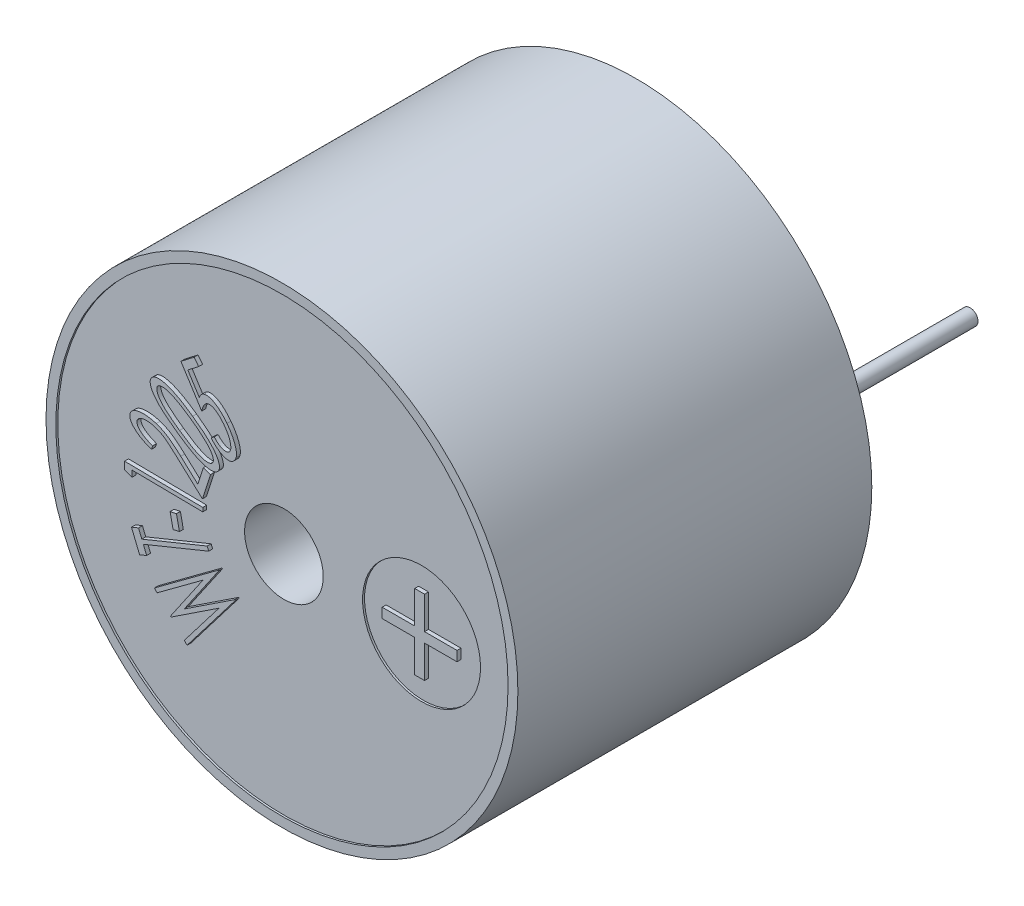
from build123d import *

# Parameters (mm, degrees)
SKETCH_1_R          = 6
EXTRUDE_1_DEPTH     = 9
SKETCH_2_R          = 0.2
EXTRUDE_2_DEPTH     = 5
SKETCH_3_R          = 5.75
CUT_EXTRUDE_1_DEPTH = 0.05
SKETCH_4_R          = 1.5
CUT_EXTRUDE_2_DEPTH = 0.05
SKETCH_5_R          = 1
CUT_EXTRUDE_3_DEPTH = 5
WRAP_1_DEPTH        = 0.1
WRAP_2_DEPTH        = 0.1


# Read off the part's stored shape, not the designer's step: 包覆1, 包覆2
with BuildPart() as part:
    # 草图1 → 凸台-拉伸1 (new body)
    with BuildSketch(Plane.XY):
        Circle(SKETCH_1_R)
    extrude(amount=EXTRUDE_1_DEPTH)

    # 草图2 → 凸台-拉伸2 (add)
    with BuildSketch(Plane.XY):
        with Locations((3.5, 0)):
            Circle(SKETCH_2_R)
        with Locations(Location((-3.5, 0, 0), (0, 0, 180))):
            Circle(SKETCH_2_R)
    extrude(amount=-EXTRUDE_2_DEPTH)

    # 草图3 → 切除-拉伸1 (cut)
    with BuildSketch(Plane.XY.offset(9)):
        Circle(SKETCH_3_R)
    extrude(amount=-CUT_EXTRUDE_1_DEPTH, mode=Mode.SUBTRACT)

    # 草图4 → 切除-拉伸2 (cut)
    with BuildSketch(Plane.XY.offset(8.95)):
        with Locations((3.5, 0)):
            Circle(SKETCH_4_R)
    extrude(amount=-CUT_EXTRUDE_2_DEPTH, mode=Mode.SUBTRACT)

    # 草图5 → 切除-拉伸3 (cut)
    with BuildSketch(Plane.XY.offset(8.95)):
        Circle(SKETCH_5_R)
    extrude(amount=-CUT_EXTRUDE_3_DEPTH, mode=Mode.SUBTRACT)

    # 包覆1 outline → 包覆1 (add)
    with BuildSketch(Plane.XY.offset(8.9)):
        Polygon((3.626336552, 0.954353789), (3.375054501, 0.954353789), (3.375054501, 0.128712764), (2.549413475, 0.128712764), (2.549413475, -0.122569288), (3.375054501, -0.122569288), (3.375054501, -0.948210313), (3.626336552, -0.948210313), (3.626336552, -0.122569288), (4.451977578, -0.122569288), (4.451977578, 0.128712764), (3.626336552, 0.128712764), align=None)
    extrude(amount=WRAP_1_DEPTH)

    # 包覆2 outline → 包覆2 (add)
    # profile 1 of 7: a face of its own
    with BuildSketch(Plane.XY.offset(8.95)):
        with BuildLine():
            add(Edge.make_bspline(
                [(-2.052905734, 2.475001752), (-2.048307487, 2.485783373), (-2.039528796, 2.506366983), (-2.023712057, 2.534250704), (-2.00555293, 2.557114523), (-1.991780954, 2.569324941), (-1.9851974, 2.575162008)],
                knots=[0, 0, 0, 0, 0.287517811, 0.548911393, 0.784361642, 1, 1, 1, 1], degree=3))
            Line((-2.052905734, 2.475001752), (-2.344171759, 2.93133188))
            Line((-2.344171759, 2.93133188), (-2.068530734, 3.144072265))
            Line((-2.068530734, 3.144072265), (-2.183915349, 3.293110726))
            Line((-2.183915349, 3.293110726), (-2.518851247, 3.034697265))
            Line((-2.518851247, 3.034697265), (-1.990005093, 2.202165213))
            add(Edge.make_bspline(
                [(-1.889043554, 2.414504957), (-1.894669979, 2.409714586), (-1.906440447, 2.399693141), (-1.921656391, 2.381034971), (-1.93649258, 2.359709884), (-1.948926645, 2.334306577), (-1.961560698, 2.306189549), (-1.97212894, 2.274297693), (-1.981722807, 2.239358345), (-1.987174029, 2.214878625), (-1.990005093, 2.202165213)],
                knots=[0, 0, 0, 0, 0.092337302, 0.193169425, 0.3002927, 0.416947482, 0.546478941, 0.686065516, 0.836959805, 1, 1, 1, 1], degree=3))
            add(Edge.make_bspline(
                [(-1.432312785, 2.197758162), (-1.452386355, 2.222634383), (-1.490680066, 2.270089959), (-1.55323302, 2.331226089), (-1.615390252, 2.381154118), (-1.66891954, 2.412590722), (-1.710949106, 2.430547991), (-1.740278055, 2.440694648), (-1.768525296, 2.445795666), (-1.795282905, 2.447517563), (-1.820946376, 2.445844675), (-1.845151551, 2.439020431), (-1.868429355, 2.429263356), (-1.882125963, 2.419457493), (-1.889043554, 2.414504957)],
                knots=[0, 0, 0, 0, 0.172818127, 0.329679645, 0.472206707, 0.603326473, 0.663857631, 0.719381823, 0.770825671, 0.818601956, 0.864266206, 0.90913463, 0.954107655, 1, 1, 1, 1], degree=3))
            add(Edge.make_bspline(
                [(-1.301703811, 1.645274188), (-1.295725788, 1.650388769), (-1.283618269, 1.660747527), (-1.26966049, 1.680686525), (-1.259574432, 1.703767461), (-1.252900742, 1.729730314), (-1.249184869, 1.758680097), (-1.250107873, 1.790800853), (-1.253605782, 1.825931633), (-1.261048379, 1.863780726), (-1.271363496, 1.903551481), (-1.284880845, 1.944303888), (-1.302112391, 1.985292135), (-1.321478195, 2.027163587), (-1.345119644, 2.069082426), (-1.37093938, 2.111859078), (-1.39997582, 2.155132658), (-1.421349945, 2.183307314), (-1.432312785, 2.197758162)],
                knots=[0, 0, 0, 0, 0.038403436, 0.07777996, 0.117882802, 0.161184835, 0.208633355, 0.260297038, 0.318142016, 0.381369523, 0.448935454, 0.519243075, 0.591375924, 0.666553778, 0.744993996, 0.82686185, 0.91119703, 1, 1, 1, 1], degree=3))
            add(Edge.make_bspline(
                [(-1.673498682, 1.792710085), (-1.660825067, 1.779476754), (-1.636642478, 1.754226169), (-1.599778126, 1.72040421), (-1.564422365, 1.692387046), (-1.531070893, 1.668791984), (-1.498051434, 1.651340488), (-1.466339167, 1.636690426), (-1.434474047, 1.627183659), (-1.403451019, 1.6214498), (-1.373837196, 1.619926214), (-1.346740782, 1.623541878), (-1.322125496, 1.631296152), (-1.308465255, 1.640646181), (-1.301703811, 1.645274188)],
                knots=[0, 0, 0, 0, 0.126987296, 0.24230509, 0.346391184, 0.43959348, 0.524919851, 0.604902256, 0.68132931, 0.754684405, 0.82323935, 0.885815461, 0.943481787, 1, 1, 1, 1], degree=3))
            Line((-1.673498682, 1.792710085), (-1.752825605, 1.731412008))
            add(Edge.make_bspline(
                [(-1.193530734, 1.495434444), (-1.201501503, 1.489792764), (-1.21734962, 1.478575529), (-1.244215894, 1.467095706), (-1.272844468, 1.459634644), (-1.303398844, 1.457155082), (-1.335712927, 1.458287696), (-1.369824331, 1.464249554), (-1.405790496, 1.474300637), (-1.443354764, 1.488914857), (-1.481754885, 1.507175539), (-1.520538478, 1.529053346), (-1.55924948, 1.554333877), (-1.598261593, 1.582837192), (-1.637143278, 1.614994387), (-1.675873241, 1.650744769), (-1.714832455, 1.689583345), (-1.739988537, 1.717279002), (-1.752825605, 1.731412008)],
                knots=[0, 0, 0, 0, 0.044376227, 0.088232336, 0.13220222, 0.178632543, 0.227334776, 0.279141084, 0.335965693, 0.39720092, 0.462510096, 0.52951706, 0.599880868, 0.673009536, 0.749499762, 0.829585101, 0.913037817, 1, 1, 1, 1], degree=3))
            add(Edge.make_bspline(
                [(-1.347777529, 2.253046624), (-1.32876415, 2.227496235), (-1.291500372, 2.177420759), (-1.24201953, 2.099903584), (-1.199877409, 2.021839215), (-1.164436632, 1.944695214), (-1.136752847, 1.869999269), (-1.117463072, 1.79952544), (-1.106863433, 1.73393054), (-1.105839013, 1.673471334), (-1.113216691, 1.618585862), (-1.130821233, 1.570231485), (-1.15694414, 1.527829018), (-1.181312427, 1.506252802), (-1.193530734, 1.495434444)],
                knots=[0, 0, 0, 0, 0.113362059, 0.222175054, 0.327056055, 0.42896919, 0.524184233, 0.610336797, 0.688741634, 0.760065712, 0.824952227, 0.884664481, 0.942170543, 1, 1, 1, 1], degree=3))
            add(Edge.make_bspline(
                [(-1.9851974, 2.575162008), (-1.976185303, 2.581396819), (-1.958236105, 2.593814554), (-1.927631852, 2.606062688), (-1.895060618, 2.613520335), (-1.860078185, 2.614957879), (-1.822990275, 2.610456452), (-1.783523733, 2.601730456), (-1.741988213, 2.58689431), (-1.698818721, 2.566718652), (-1.65415101, 2.542610725), (-1.609557886, 2.513470938), (-1.565341831, 2.480170406), (-1.520969914, 2.443254819), (-1.477285471, 2.401714015), (-1.433762362, 2.35595447), (-1.389971258, 2.306407974), (-1.362035623, 2.271078478), (-1.347777529, 2.253046624)],
                knots=[0, 0, 0, 0, 0.042186807, 0.084022538, 0.1262943, 0.170676028, 0.218382229, 0.270159486, 0.326406724, 0.388227015, 0.453972137, 0.522177348, 0.593627011, 0.667551835, 0.744861044, 0.826169461, 0.911278469, 1, 1, 1, 1], degree=3))
        make_face()
    # profile 2 of 7: a face of its own
    with BuildSketch(Plane.XY.offset(8.95)):
        with BuildLine():
            add(Edge.make_bspline(
                [(-3.271095909, 2.291917064), (-3.266194509, 2.298211962), (-3.25640826, 2.310780503), (-3.238584281, 2.326942275), (-3.218101081, 2.340113694), (-3.195585982, 2.351692841), (-3.170037984, 2.359674078), (-3.142384448, 2.366366016), (-3.111994608, 2.369665142), (-3.079180162, 2.370972726), (-3.043987066, 2.369058441), (-3.006578008, 2.365319138), (-2.967120267, 2.35755522), (-2.925126745, 2.34829932), (-2.88110259, 2.335193156), (-2.834888515, 2.319490615), (-2.786403721, 2.300988035), (-2.73535481, 2.27963799), (-2.681477702, 2.255254053), (-2.624930354, 2.226562405), (-2.565222367, 2.194076414), (-2.502519075, 2.157596638), (-2.436634381, 2.117439778), (-2.367765574, 2.073274973), (-2.295669273, 2.02533709), (-2.247117549, 1.991276255), (-2.222217704, 1.973808089)],
                knots=[0, 0, 0, 0, 0.020398542, 0.040728208, 0.061209666, 0.082614761, 0.105318293, 0.129533945, 0.155358926, 0.183411869, 0.213528403, 0.245506553, 0.279571288, 0.316394515, 0.355560336, 0.397075928, 0.441331939, 0.488379941, 0.538715363, 0.592686998, 0.650667726, 0.712707469, 0.778376978, 0.848177524, 0.92213755, 1, 1, 1, 1], degree=3))
            add(Edge.make_bspline(
                [(-2.610438858, 1.420522833), (-2.636429007, 1.438839157), (-2.686851495, 1.474373951), (-2.758830885, 1.527908256), (-2.826130752, 1.57857131), (-2.88738809, 1.628023273), (-2.944379066, 1.67416852), (-2.995033219, 1.719236038), (-3.04097442, 1.761589083), (-3.081661796, 1.802291283), (-3.118090741, 1.84149963), (-3.150829962, 1.879557993), (-3.18076703, 1.916274945), (-3.206750281, 1.952629615), (-3.23011312, 1.98755845), (-3.249749018, 2.021770766), (-3.266414239, 2.054723323), (-3.279648814, 2.086743541), (-3.289727478, 2.117548347), (-3.296709191, 2.147016612), (-3.300447342, 2.175088743), (-3.300764411, 2.201544362), (-3.298716393, 2.226568098), (-3.292304629, 2.249867217), (-3.283928076, 2.272167304), (-3.275350743, 2.285368524), (-3.271095909, 2.291917064)],
                knots=[0, 0, 0, 0, 0.081558884, 0.158229249, 0.230103198, 0.297621874, 0.360170764, 0.418179436, 0.471506906, 0.520438878, 0.565769015, 0.608760539, 0.649207672, 0.687239729, 0.723345306, 0.756956139, 0.788363049, 0.818009197, 0.845743009, 0.871420183, 0.895597863, 0.918210444, 0.939208396, 0.959731502, 0.980024585, 1, 1, 1, 1], degree=3))
            add(Edge.make_bspline(
                [(-1.568772191, 1.09520232), (-1.573560761, 1.089062525), (-1.583176544, 1.076733386), (-1.600509151, 1.060471773), (-1.620797524, 1.047445627), (-1.643178178, 1.036342198), (-1.668150732, 1.028093289), (-1.695543413, 1.022110522), (-1.725325629, 1.018615765), (-1.757480348, 1.017401567), (-1.791914694, 1.019085798), (-1.828395153, 1.023733964), (-1.867145458, 1.030375494), (-1.90778455, 1.04076341), (-1.95085819, 1.052920487), (-1.995668166, 1.068990158), (-2.042953244, 1.086828334), (-2.092587203, 1.107832099), (-2.144934394, 1.132500016), (-2.200777, 1.16110559), (-2.260332883, 1.19380236), (-2.323219431, 1.231448808), (-2.390026512, 1.27246762), (-2.460323377, 1.318032386), (-2.534303106, 1.367605446), (-2.584582629, 1.402551722), (-2.610438858, 1.420522833)],
                knots=[0, 0, 0, 0, 0.01999794, 0.040157262, 0.060721663, 0.081753465, 0.104223551, 0.128126718, 0.153715495, 0.181195985, 0.210748676, 0.242213165, 0.275679287, 0.311728635, 0.349968401, 0.390678223, 0.434028918, 0.479868594, 0.529161475, 0.582739389, 0.641119649, 0.703757725, 0.771109403, 0.842615682, 0.919065165, 1, 1, 1, 1], degree=3))
            add(Edge.make_bspline(
                [(-2.222217704, 1.973808089), (-2.197618648, 1.956217445), (-2.149706656, 1.921955854), (-2.080158504, 1.871284018), (-2.015759785, 1.821401122), (-1.955618698, 1.773679757), (-1.900662745, 1.726931418), (-1.850097317, 1.682266814), (-1.804360935, 1.638876261), (-1.762849619, 1.597137595), (-1.725541707, 1.55654833), (-1.691748225, 1.517350518), (-1.661642637, 1.478954091), (-1.634224888, 1.442170893), (-1.611134649, 1.405692684), (-1.590323337, 1.371010769), (-1.573519876, 1.336954091), (-1.5601649, 1.303986238), (-1.550263823, 1.272305317), (-1.542724203, 1.242413735), (-1.539015013, 1.213896127), (-1.538718825, 1.187046911), (-1.540719255, 1.161489261), (-1.547096782, 1.137770883), (-1.555589057, 1.115168136), (-1.564366847, 1.1018742), (-1.568772191, 1.09520232)],
                knots=[0, 0, 0, 0, 0.077491573, 0.150931629, 0.220472435, 0.286206978, 0.347636471, 0.405325403, 0.459062847, 0.509151676, 0.556134178, 0.600303219, 0.641722187, 0.68114658, 0.717785997, 0.752295678, 0.78473981, 0.814987302, 0.843342479, 0.869736312, 0.893887513, 0.916817491, 0.938473664, 0.95930577, 0.979576629, 1, 1, 1, 1], degree=3))
        make_face()
        with BuildLine():
            add(Edge.make_bspline(
                [(-1.713403601, 1.201372192), (-1.708071094, 1.211015959), (-1.697017568, 1.23100611), (-1.692924863, 1.267781949), (-1.699206268, 1.308649427), (-1.713986865, 1.35452733), (-1.738957111, 1.404803863), (-1.774898973, 1.458607563), (-1.821618556, 1.515722099), (-1.857999555, 1.553278423), (-1.877265781, 1.573167064)],
                knots=[0, 0, 0, 0, 0.07573361, 0.156984946, 0.250279861, 0.360882464, 0.489563468, 0.637878582, 0.808231949, 1, 1, 1, 1], degree=3))
            add(Edge.make_bspline(
                [(-2.553547832, 1.495442705), (-2.531291525, 1.479884388), (-2.488300502, 1.449831425), (-2.425039645, 1.407220961), (-2.365693399, 1.368091397), (-2.309992477, 1.332608818), (-2.25766154, 1.3014835), (-2.209454248, 1.273203534), (-2.164464894, 1.249190513), (-2.110956882, 1.222512025), (-2.049022883, 1.196133361), (-1.979899498, 1.171461769), (-1.91679049, 1.156053272), (-1.860342251, 1.149743386), (-1.811022328, 1.151227687), (-1.769890127, 1.160070521), (-1.735817769, 1.175717421), (-1.720681992, 1.193041504), (-1.713403601, 1.201372192)],
                knots=[0, 0, 0, 0, 0.08630028, 0.16670049, 0.242392216, 0.312216216, 0.376561025, 0.435890991, 0.489817994, 0.538599153, 0.625871864, 0.703587966, 0.771635049, 0.831816624, 0.883639912, 0.927604253, 0.96518682, 1, 1, 1, 1], degree=3))
            add(Edge.make_bspline(
                [(-3.114845909, 2.186147833), (-3.120181625, 2.176503588), (-3.131306378, 2.156395724), (-3.135307888, 2.119194978), (-3.129035001, 2.077698276), (-3.114451036, 2.030991927), (-3.088785882, 1.980443142), (-3.053242193, 1.926378907), (-3.006899674, 1.869544002), (-2.961059031, 1.820454319), (-2.917978573, 1.779078314), (-2.880091155, 1.744807526), (-2.837304339, 1.708673266), (-2.789959089, 1.66993928), (-2.737356493, 1.629817132), (-2.68043717, 1.586805952), (-2.618829999, 1.541525037), (-2.575768829, 1.511128387), (-2.553547832, 1.495442705)],
                knots=[0, 0, 0, 0, 0.034740762, 0.072433093, 0.116071476, 0.167617478, 0.227214285, 0.295605, 0.372886723, 0.459965152, 0.508888446, 0.562672783, 0.622284699, 0.686842869, 0.757043895, 0.832501391, 0.913565145, 1, 1, 1, 1], degree=3))
            add(Edge.make_bspline(
                [(-2.272297832, 1.895683089), (-2.292285893, 1.909635466), (-2.33137793, 1.936923097), (-2.389282546, 1.975761926), (-2.445224762, 2.011303532), (-2.498480538, 2.04492158), (-2.550053083, 2.075141512), (-2.599308631, 2.102852039), (-2.646267484, 2.127826628), (-2.691028643, 2.149880461), (-2.733798335, 2.169037353), (-2.774054884, 2.186561698), (-2.812545194, 2.200778009), (-2.848507863, 2.213084728), (-2.882572813, 2.222206784), (-2.91429673, 2.229672113), (-2.944060695, 2.234066147), (-2.979243256, 2.236717153), (-3.018256564, 2.235390396), (-3.05904242, 2.2270025), (-3.092667073, 2.21148272), (-3.107687958, 2.194324362), (-3.114845909, 2.186147833)],
                knots=[0, 0, 0, 0, 0.077537471, 0.151645407, 0.2217594, 0.288356984, 0.351959449, 0.411869901, 0.468118709, 0.521123553, 0.570554, 0.617185429, 0.660739412, 0.701039543, 0.738036244, 0.7728699, 0.804650556, 0.833614985, 0.885059733, 0.928140889, 0.965756744, 1, 1, 1, 1], degree=3))
            add(Edge.make_bspline(
                [(-1.877265781, 1.573167064), (-1.90409879, 1.599112516), (-1.960222231, 1.653379561), (-2.053917791, 1.732199715), (-2.158209584, 1.814578188), (-2.233318835, 1.867973069), (-2.272297832, 1.895683089)],
                knots=[0, 0, 0, 0, 0.219260617, 0.458601584, 0.719033714, 1, 1, 1, 1], degree=3))
        make_face(mode=Mode.SUBTRACT)
    # profile 3 of 7: a face of its own
    with BuildSketch(Plane.XY.offset(8.95)):
        with BuildLine():
            add(Edge.make_bspline(
                [(-3.268370996, 0.722213855), (-3.291174198, 0.7300987), (-3.335712634, 0.745499112), (-3.399413203, 0.772501387), (-3.459716237, 0.799572493), (-3.515382556, 0.829689497), (-3.567794068, 0.860198388), (-3.615682058, 0.893089638), (-3.659844956, 0.927313723), (-3.699465475, 0.962949584), (-3.73430198, 0.999122549), (-3.763447671, 1.03522136), (-3.786561762, 1.071013245), (-3.803803493, 1.106302981), (-3.814345215, 1.141380459), (-3.819528335, 1.175817974), (-3.818081396, 1.210033848), (-3.812185622, 1.231772321), (-3.809236381, 1.242646547)],
                knots=[0, 0, 0, 0, 0.088847287, 0.173533489, 0.254754133, 0.332217275, 0.40654297, 0.478039278, 0.546034818, 0.612216046, 0.674147342, 0.730844328, 0.782834604, 0.830801335, 0.874997656, 0.917225588, 0.958593792, 1, 1, 1, 1], degree=3))
            Line((-3.268370996, 0.722213855), (-3.239124201, 0.812358086))
            add(Edge.make_bspline(
                [(-3.630550483, 1.178944624), (-3.632559885, 1.171382792), (-3.636531094, 1.156438237), (-3.63768968, 1.133031911), (-3.634362149, 1.109583693), (-3.62669941, 1.086012415), (-3.616045952, 1.061798284), (-3.600362912, 1.037611425), (-3.580665161, 1.013406661), (-3.557269377, 0.98884237), (-3.530136069, 0.964519955), (-3.499019839, 0.940946615), (-3.464590888, 0.917675292), (-3.426414186, 0.89528411), (-3.38458526, 0.873714494), (-3.339337522, 0.852649899), (-3.29073988, 0.831497255), (-3.256684994, 0.818869653), (-3.239124201, 0.812358086)],
                knots=[0, 0, 0, 0, 0.040310607, 0.079666416, 0.120035947, 0.161908435, 0.20727408, 0.256243036, 0.31019161, 0.368228379, 0.431214734, 0.498099639, 0.569621605, 0.645657375, 0.726455299, 0.812512883, 0.903320119, 1, 1, 1, 1], degree=3))
            add(Edge.make_bspline(
                [(-3.173819714, 1.256668983), (-3.199853633, 1.264329607), (-3.250171475, 1.279135909), (-3.325896884, 1.291211963), (-3.398421511, 1.294353162), (-3.456387329, 1.288982811), (-3.499473781, 1.28061506), (-3.528201143, 1.272209247), (-3.553659316, 1.261857776), (-3.575912323, 1.249407754), (-3.595047348, 1.235052679), (-3.610461949, 1.218267678), (-3.622958974, 1.199741264), (-3.628016363, 1.185886748), (-3.630550483, 1.178944624)],
                knots=[0, 0, 0, 0, 0.16147556, 0.312096759, 0.455357478, 0.592738226, 0.657621555, 0.716505376, 0.770707877, 0.820918443, 0.868002131, 0.912460291, 0.956136218, 1, 1, 1, 1], degree=3))
            add(Edge.make_bspline(
                [(-2.639765227, 0.890883727), (-2.65603047, 0.905737898), (-2.687380672, 0.934368352), (-2.733079075, 0.975208354), (-2.775531283, 1.012646946), (-2.815179148, 1.046170776), (-2.851622372, 1.076412488), (-2.885226428, 1.102768027), (-2.915642217, 1.125665601), (-2.952123277, 1.151582696), (-2.997296977, 1.179549708), (-3.053173354, 1.209567142), (-3.112291086, 1.235129554), (-3.153161495, 1.249437126), (-3.173819714, 1.256668983)],
                knots=[0, 0, 0, 0, 0.101178516, 0.19501503, 0.281517147, 0.361161334, 0.433499093, 0.499029795, 0.557305501, 0.60836398, 0.704533447, 0.801130419, 0.899480051, 1, 1, 1, 1], degree=3))
            Line((-2.639765227, 0.890883727), (-1.97309856, 0.27910488))
            Line((-1.97309856, 0.27910488), (-1.767169073, 0.916925393))
            Line((-1.767169073, 0.916925393), (-1.950262022, 0.976220265))
            Line((-1.950262022, 0.976220265), (-2.09008574, 0.542726675))
            Line((-2.09008574, 0.542726675), (-2.52357933, 0.940963855))
            add(Edge.make_bspline(
                [(-3.14857933, 1.34921706), (-3.122282676, 1.340194095), (-3.070287165, 1.322353281), (-2.995533044, 1.290340762), (-2.92491138, 1.254071224), (-2.868780125, 1.21996553), (-2.823606192, 1.190199369), (-2.788193798, 1.163686977), (-2.749483896, 1.135237624), (-2.709191923, 1.10233714), (-2.665920526, 1.067000127), (-2.62053765, 1.027803481), (-2.572718452, 0.985607153), (-2.540235569, 0.956096186), (-2.52357933, 0.940963855)],
                knots=[0, 0, 0, 0, 0.110691908, 0.218867483, 0.323529094, 0.426598878, 0.48029234, 0.538907282, 0.602729655, 0.671587689, 0.746018627, 0.82522368, 0.91037999, 1, 1, 1, 1], degree=3))
            add(Edge.make_bspline(
                [(-3.809236381, 1.242646547), (-3.805359897, 1.253123297), (-3.797718077, 1.273776405), (-3.779266299, 1.301439074), (-3.756825254, 1.326257083), (-3.728872755, 1.346966051), (-3.696959946, 1.36543812), (-3.659772112, 1.379416043), (-3.618064266, 1.390725911), (-3.572145316, 1.398376841), (-3.523408483, 1.402902186), (-3.472972374, 1.405223416), (-3.421470891, 1.403249594), (-3.368889747, 1.399011761), (-3.315262708, 1.391250164), (-3.260638109, 1.380305358), (-3.204601843, 1.366931039), (-3.167477248, 1.355192467), (-3.14857933, 1.34921706)],
                knots=[0, 0, 0, 0, 0.045775321, 0.090238161, 0.135696374, 0.182689898, 0.23260052, 0.286834339, 0.345429848, 0.410049442, 0.477892819, 0.546568417, 0.617419041, 0.689586644, 0.763340357, 0.839995326, 0.918551161, 1, 1, 1, 1], degree=3))
        make_face()
    # profile 4 of 7: a face of its own
    with BuildSketch(Plane.XY.offset(8.95)):
        Polygon((-1.962343273, 0.094921885), (-3.951525965, 0.118960347), (-3.953929811, -0.076151833), (-3.760019555, -0.138251192), (-3.75801635, 0.017998808), (-1.963545196, -0.003635807), align=None)
    # profile 5 of 7: a face of its own
    with BuildSketch(Plane.XY.offset(8.95)):
        Polygon((-2.633111123, -0.377506548), (-2.794970098, -0.411961676), (-2.719248944, -0.769734112), (-2.557389969, -0.735278984), align=None)
    # profile 6 of 7: a face of its own
    with BuildSketch(Plane.XY.offset(8.95)):
        Polygon((-3.776557423, -1.246436616), (-3.570227295, -1.751644949), (-3.391140756, -1.678327641), (-3.475275372, -1.472398154), (-1.812615115, -0.793712257), (-1.851076654, -0.699962257), (-3.51373691, -1.378648154), (-3.597470885, -1.173119308), align=None)
    # profile 7 of 7: a face of its own
    with BuildSketch(Plane.XY.offset(8.95)):
        Polygon((-1.551169324, -1.917607646), (-2.432980222, -3.067848031), (-2.36206676, -3.139562774), (-1.138909709, -1.543408928), (-1.151730222, -1.530187774), (-2.433781504, -2.376341621), (-1.56519176, -1.111117262), (-1.578412914, -1.097495467), (-3.194598812, -2.295412133), (-3.124486632, -2.366726236), (-1.959021889, -1.504146108), (-2.785143683, -2.710476236), (-2.771521889, -2.724498672), align=None)
    extrude(amount=WRAP_2_DEPTH)


solid = part.part
